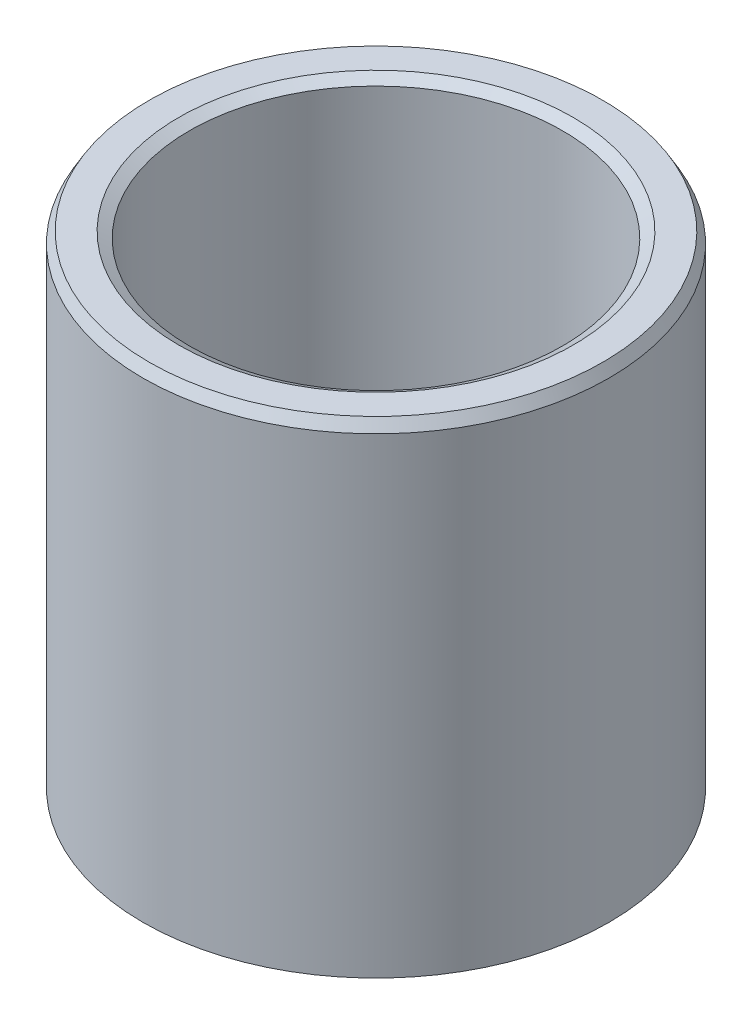
from build123d import *
from OCP.BRepFilletAPI import BRepFilletAPI_MakeChamfer

# Parameters (mm, degrees)
SKETCH1_R           = 60
BOSS_EXTRUDE1_DEPTH = 125.700634766
SKETCH2_R           = 48.028056274
CUT_EXTRUDE1_DEPTH  = 152.65965047
CHAMFER1_SIZE       = 2.751470634
CHAMFER1_SIZE2      = 1.588562311


with BuildPart() as part:
    # Sketch1 → Boss-Extrude1 (new body)
    with BuildSketch(Plane(origin=(0, 0, 0), x_dir=(1, 0, 0), z_dir=(0, 1, 0))):
        Circle(SKETCH1_R)
    extrude(amount=BOSS_EXTRUDE1_DEPTH)

    # Sketch2 → Cut-Extrude1 (cut, through all)
    with BuildSketch(Plane(origin=(0, 0, 0), x_dir=(1, 0, 0), z_dir=(0, 1, 0))):
        Circle(SKETCH2_R)
    extrude(amount=CUT_EXTRUDE1_DEPTH, mode=Mode.SUBTRACT)

    # Chamfer1: one chamfer whose edges measure the first distance from different faces: ONE call of the kernel's chamfer builder (chamfer() names one face for all edges)
    chamfer1_edges_1 = [part.edges().sort_by_distance(p)[0] for p in [
        (-48.028056274, 125.700634766, 0),
    ]]
    chamfer1_side_1 = [part.faces().sort_by_distance(p)[0] for p in [
        (-58.302943725, 125.700634766, 0),
    ]]
    chamfer1_edges_2 = [part.edges().sort_by_distance(p)[0] for p in [
        (-48.028056274, 0, 0),
    ]]
    chamfer1_side_2 = [part.faces().sort_by_distance(p)[0] for p in [
        (-48.028056274, 62.850317383, 0),
    ]]
    chamfer1_edges_3 = [part.edges().sort_by_distance(p)[0] for p in [
        (-60, 0, 0),
    ]]
    chamfer1_side_3 = [part.faces().sort_by_distance(p)[0] for p in [
        (-58.302943725, 0, 0),
    ]]
    chamfer1_edges_4 = [part.edges().sort_by_distance(p)[0] for p in [
        (-60, 125.700634766, 0),
    ]]
    chamfer1_side_4 = [part.faces().sort_by_distance(p)[0] for p in [
        (-60, 62.850317383, 0),
    ]]
    chamfer1 = BRepFilletAPI_MakeChamfer(part.part.solid().wrapped)
    for e in chamfer1_edges_1:
        chamfer1.Add(CHAMFER1_SIZE, CHAMFER1_SIZE2, e.wrapped, chamfer1_side_1[0].wrapped)  # the first distance lies on this face
    for e in chamfer1_edges_2:
        chamfer1.Add(CHAMFER1_SIZE, CHAMFER1_SIZE2, e.wrapped, chamfer1_side_2[0].wrapped)  # the first distance lies on this face
    for e in chamfer1_edges_3:
        chamfer1.Add(CHAMFER1_SIZE, CHAMFER1_SIZE2, e.wrapped, chamfer1_side_3[0].wrapped)  # the first distance lies on this face
    for e in chamfer1_edges_4:
        chamfer1.Add(CHAMFER1_SIZE, CHAMFER1_SIZE2, e.wrapped, chamfer1_side_4[0].wrapped)  # the first distance lies on this face
    add(Compound.cast(chamfer1.Shape()), mode=Mode.REPLACE)


solid = part.part
